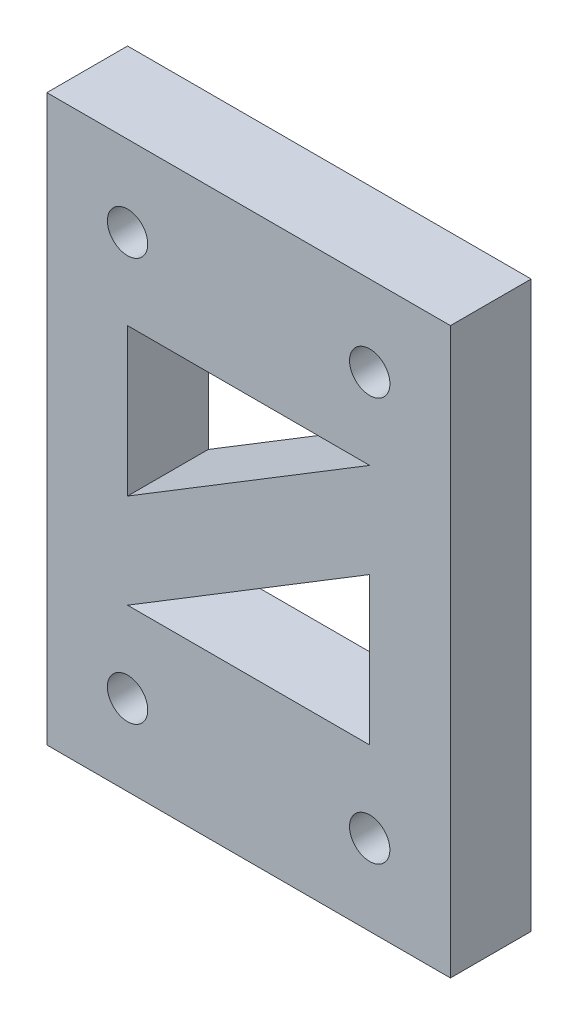
from build123d import *

# Parameters (mm, degrees)
SKETCH1_W          = 50
SKETCH1_H          = 70
BASE_FLANGE1_DEPTH = 10
CUT_EXTRUDE1_REACH = 88.603
SKETCH6_R          = 2.5


# Sheet-metal steps are written as plain solids
with BuildPart() as part:
    # Sketch1 → Base-Flange1 (new body)
    with BuildSketch(Plane.XY):
        with Locations((25, 35)):
            Rectangle(SKETCH1_W, SKETCH1_H)
    extrude(amount=-BASE_FLANGE1_DEPTH)

    # Sketch6 → Cut-Extrude1 (cut, up to next)
    with BuildSketch(Plane.XY, mode=Mode.PRIVATE) as cut_extrude1_sk1:
        with Locations((40, 60)):
            Circle(SKETCH6_R)
    cut_extrude1_tool1 = extrude(cut_extrude1_sk1.sketch, amount=-CUT_EXTRUDE1_REACH, mode=Mode.PRIVATE) & part.part
    # Sketch6 → Cut-Extrude1 (cut, up to next)
    with BuildSketch(Plane.XY, mode=Mode.PRIVATE) as cut_extrude1_sk2:
        with Locations((10, 10)):
            Circle(SKETCH6_R)
    cut_extrude1_tool2 = extrude(cut_extrude1_sk2.sketch, amount=-CUT_EXTRUDE1_REACH, mode=Mode.PRIVATE) & part.part
    # Sketch6 → Cut-Extrude1 (cut, up to next)
    with BuildSketch(Plane.XY, mode=Mode.PRIVATE) as cut_extrude1_sk3:
        with Locations(Location((10, 60, 0), (0, 0, 180))):
            Circle(SKETCH6_R)
    cut_extrude1_tool3 = extrude(cut_extrude1_sk3.sketch, amount=-CUT_EXTRUDE1_REACH, mode=Mode.PRIVATE) & part.part
    # Sketch6 → Cut-Extrude1 (cut, up to next)
    with BuildSketch(Plane.XY, mode=Mode.PRIVATE) as cut_extrude1_sk4:
        with Locations(Location((40, 10, 0), (0, 0, 180))):
            Circle(SKETCH6_R)
    cut_extrude1_tool4 = extrude(cut_extrude1_sk4.sketch, amount=-CUT_EXTRUDE1_REACH, mode=Mode.PRIVATE) & part.part
    # Sketch6 → Cut-Extrude1 (cut, up to next)
    with BuildSketch(Plane.XY, mode=Mode.PRIVATE) as cut_extrude1_sk5:
        Polygon((40, 38.288353904), (40, 20), (10, 20), align=None)
    cut_extrude1_tool5 = extrude(cut_extrude1_sk5.sketch, amount=-CUT_EXTRUDE1_REACH, mode=Mode.PRIVATE) & part.part
    # Sketch6 → Cut-Extrude1 (cut, up to next)
    with BuildSketch(Plane.XY, mode=Mode.PRIVATE) as cut_extrude1_sk6:
        Polygon((40, 50), (10, 31.711646096), (10, 50), align=None)
    cut_extrude1_tool6 = extrude(cut_extrude1_sk6.sketch, amount=-CUT_EXTRUDE1_REACH, mode=Mode.PRIVATE) & part.part
    add(cut_extrude1_tool1.solids().sort_by_distance((40, 60, 0))[0], mode=Mode.SUBTRACT)
    add(cut_extrude1_tool2.solids().sort_by_distance((10, 10, 0))[0], mode=Mode.SUBTRACT)
    add(cut_extrude1_tool3.solids().sort_by_distance((10, 60, 0))[0], mode=Mode.SUBTRACT)
    add(cut_extrude1_tool4.solids().sort_by_distance((40, 10, 0))[0], mode=Mode.SUBTRACT)
    add(cut_extrude1_tool5.solids().sort_by_distance((30, 26.096118, 0))[0], mode=Mode.SUBTRACT)
    add(cut_extrude1_tool6.solids().sort_by_distance((20, 43.903882, 0))[0], mode=Mode.SUBTRACT)


solid = part.part
